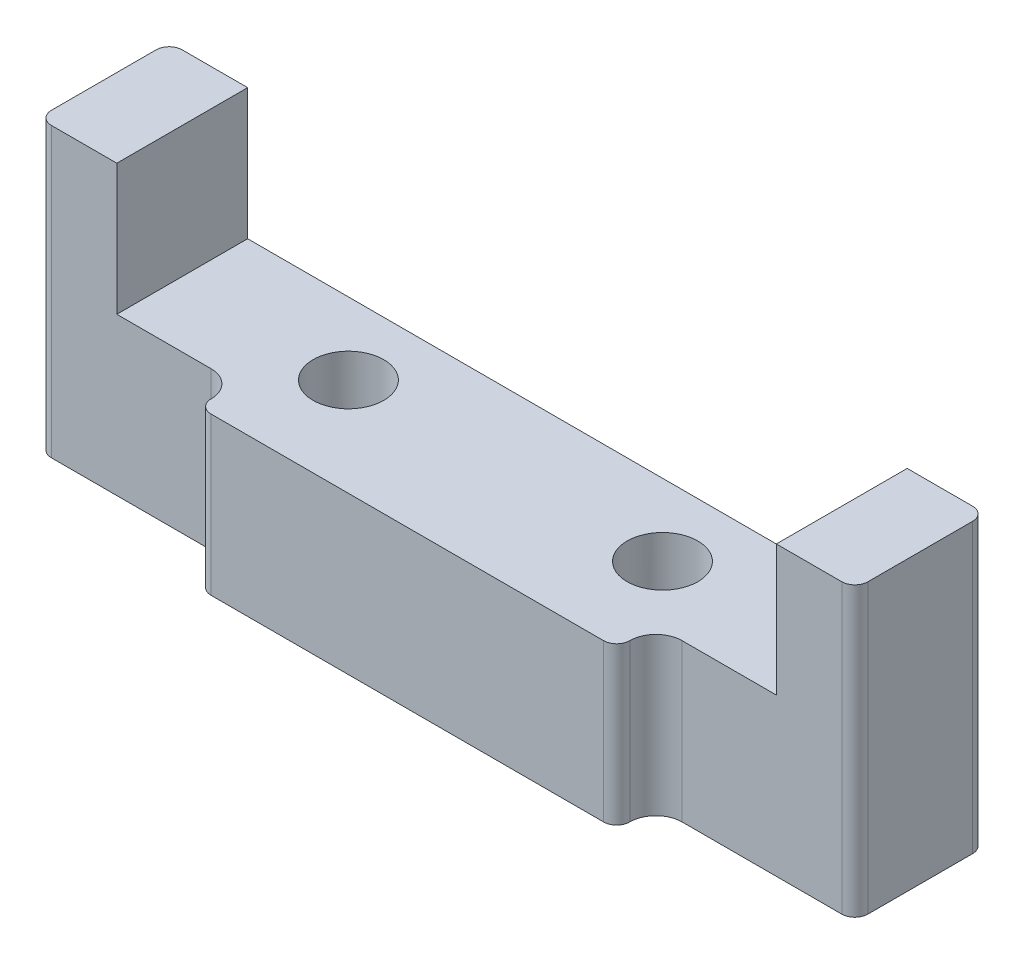
from build123d import *

# Parameters (mm, degrees)
EXTRUDE_1_DEPTH     = 5
SKETCH_2_W          = 16
SKETCH_2_H          = 6
EXTRUDE_2_DEPTH     = 1.5
SKETCH_3_R          = 1.35
CUT_EXTRUDE_1_DEPTH = 21.164572894
FILLET_1_R          = 1
FILLET_2_R          = 0.5


with BuildPart() as part:
    # 草图1 → 凸台-拉伸1 (new body)
    with BuildSketch(Plane.XY):
        Polygon((-12.6, 2.5), (-15.6, 2.5), (-15.6, -8.5), (15.6, -8.5), (15.6, 2.5), (12.6, 2.5), (12.6, -2.5), (-12.6, -2.5), align=None)
    extrude(amount=EXTRUDE_1_DEPTH)

    # 草图2 → 凸台-拉伸2 (add)
    with BuildSketch(Plane.XY.offset(5)):
        with Locations((0, -5.5)):
            Rectangle(SKETCH_2_W, SKETCH_2_H)
    extrude(amount=EXTRUDE_2_DEPTH)

    # 草图3 → 切除-拉伸1 (cut, through all)
    with BuildSketch(Plane.XZ.offset(8.5)):
        with Locations(Location((-6, 2.75, 0), (0, 0, 270))):
            Circle(SKETCH_3_R)
        with Locations((6, 2.75)):
            Circle(SKETCH_3_R)
    extrude(amount=-CUT_EXTRUDE_1_DEPTH, mode=Mode.SUBTRACT)

    # 圆角1
    fillet_1_edges = [part.edges().sort_by_distance(p)[0] for p in [
        (-8, -5.5, 5),
        (8, -5.5, 5),
    ]]
    fillet(fillet_1_edges, radius=FILLET_1_R)

    # 圆角2
    fillet_2_edges = [part.edges().sort_by_distance(p)[0] for p in [
        (15.6, -3, 0),
        (15.6, -3, 5),
        (8, -5.5, 6.5),
        (-8, -5.5, 6.5),
        (-15.6, -3, 5),
        (-15.6, -3, 0),
    ]]
    fillet(fillet_2_edges, radius=FILLET_2_R - 0.0001)  # a hair under: the kernel refuses the full size


solid = part.part
